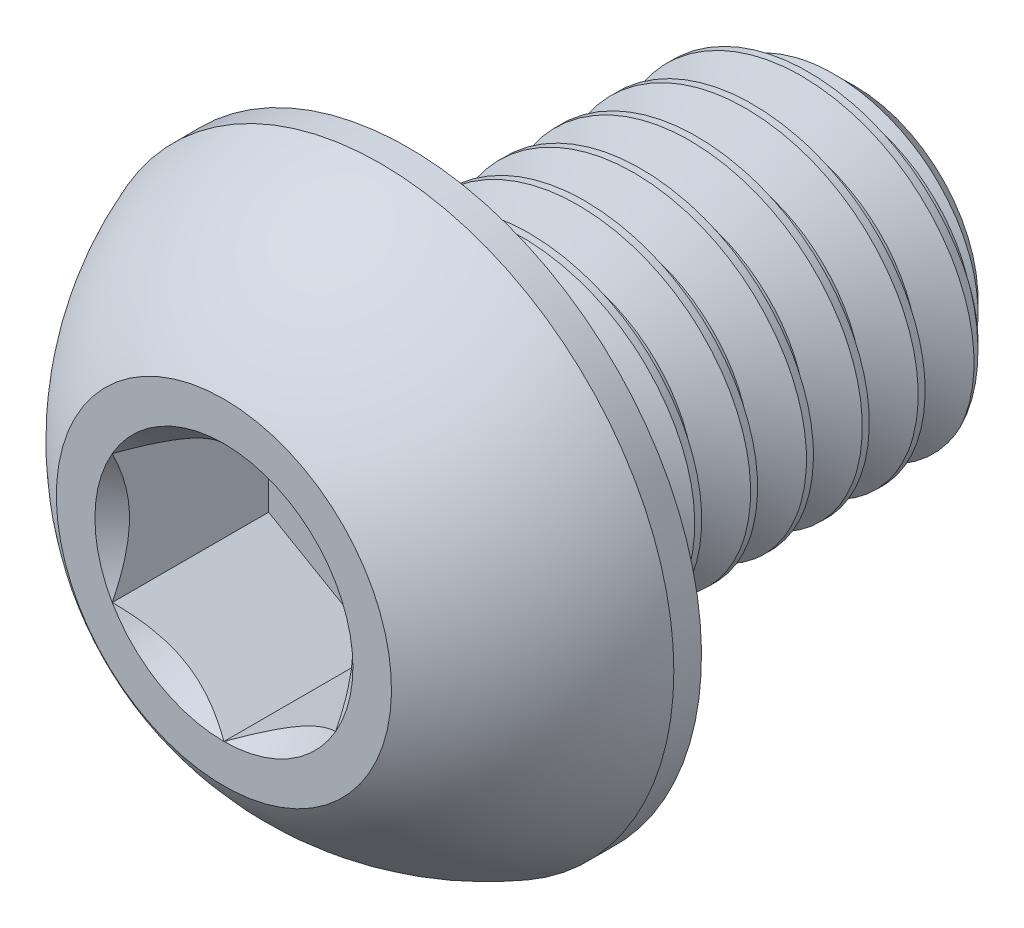
from build123d import *

# Parameters (mm, degrees)
CUT_EXTRUDE1_DEPTH = 2.8
CUT_SWEEP1_PITCH   = 1


# Read off the part's stored shape, not the designer's step: Split1
with BuildPart() as part:
    # Sketch2 → Revolve1 (revolve)
    with BuildSketch(Plane(origin=(0, 0, 0), x_dir=(0, 0, -1), z_dir=(1, 0, 0)), mode=Mode.PRIVATE) as revolve1_sk:
        with BuildLine():
            Line((-5.65, 0), (5.65, 0))
            Line((5.65, 0), (5.65, 2.2))
            Line((5.65, 2.2), (4.85, 3))
            Line((4.85, 3), (-2.35, 3))
            Line((-2.35, 3), (-2.35, 5.25))
            Line((-2.35, 5.25), (-2.845, 5.25))
            ThreePointArc((-2.845, 5.25), (-4.433520981, 4.356906156), (-5.65, 3))
            Line((-5.65, 3), (-5.65, 0))
        make_face()
    revolve(revolve1_sk.sketch.rotate(Axis((0, 0, 5.65), (0, 0, -1)), 180), axis=Axis((0, 0, 5.65), (0, 0, -1)))

    # Sketch3 → Cut-Extrude1 (cut)
    with BuildSketch(Plane.XY.offset(5.65)):
        Polygon((0, 2.309401077), (-2, 1.154700538), (-2, -1.154700538), (0, -2.309401077), (2, -1.154700538), (2, 1.154700538), align=None)
    extrude(amount=-CUT_EXTRUDE1_DEPTH, mode=Mode.SUBTRACT)

    # Cut-Extrude2 cone 1 section (through the dimple's axis) → Cut-Extrude2 (revolve, cut)
    with BuildSketch(Plane(origin=(0, 0, 5.65), x_dir=(0, -1, 0), z_dir=(1, 0, 0))):
        Polygon((0, 0), (2.309401077, 0), (0, 2.309401077), align=None)
    revolve(axis=Axis((0, 0, 5.65), (0, 0, -1)), mode=Mode.SUBTRACT)


with BuildPart() as body_2:
    # Split1: the piece on the far side of the plane
    add(part.part)
    split(bisect_by=Plane.XY.offset(2.35), keep=Keep.BOTTOM)

    # Cut-Sweep1: the profile of Sketch6 screwed along a right-hand helix of 9 turns, 8 arcs to a turn; built about Z, then put on its axis
    cut_sweep1_z = Axis((0, 0, 0), (0, 0, 1))
    cut_sweep1_corners = [(2.350480947, 0, -0.375), (2.350480947, 0, -0.5), (3.054126588, 0, -0.90625), (3.054126588, 0, 0.03125)]
    with BuildLine(mode=Mode.PRIVATE) as cut_sweep1_profile:
        Line(cut_sweep1_corners[0], cut_sweep1_corners[1])
        Line(cut_sweep1_corners[1], cut_sweep1_corners[2])
        Line(cut_sweep1_corners[2], cut_sweep1_corners[3])
        Line(cut_sweep1_corners[3], cut_sweep1_corners[0])
    cut_sweep1_cap = Face(cut_sweep1_profile.wire())
    cut_sweep1_turn_angles = [0, 22.5, 45, 67.5, 90, 112.5, 135, 157.5, 180, 202.5, 225, 247.5, 270, 292.5, 315, 337.5, 360]
    cut_sweep1_turn_weights = [1, 0.9238795325112867, 1, 0.9238795325112867, 1, 0.9238795325112867, 1, 0.9238795325112867, 1, 0.9238795325112867, 1, 0.9238795325112867, 1, 0.9238795325112867, 1, 0.9238795325112867, 1]
    cut_sweep1_turn_rails = [Edge.make_bspline([Vector(p[0], p[1], 0).rotate(cut_sweep1_z, cut_sweep1_turn_angles[k]) / cut_sweep1_turn_weights[k] + Vector(0, 0, p[2] + CUT_SWEEP1_PITCH * cut_sweep1_turn_angles[k] / 360) for k in range(17)], [0, 0, 0, 1, 1, 2, 2, 3, 3, 4, 4, 5, 5, 6, 6, 7, 7, 8, 8, 8], 2, cut_sweep1_turn_weights) for p in cut_sweep1_corners]
    cut_sweep1_turn_sides = [Face.make_surface_from_curves(cut_sweep1_turn_rails[p[0]], cut_sweep1_turn_rails[p[1]]) for p in [(0, 1), (1, 2), (2, 3), (3, 0)]]
    cut_sweep1_turn = Solid(Shell([*cut_sweep1_turn_sides, cut_sweep1_cap, cut_sweep1_cap.rotate(cut_sweep1_z, 360).moved(Location((0, 0, CUT_SWEEP1_PITCH * 360 / 360)))]))
    cut_sweep1_each = [*[cut_sweep1_turn.moved(Location((0, 0, CUT_SWEEP1_PITCH * i))) for i in range(9)]]
    add(Plane(origin=(0, 0, -5.65), x_dir=(0, 1, 0), z_dir=(0, 0, 1)) * Compound([cut_sweep1_each[i] for i in range(0, 9, 2)]), mode=Mode.SUBTRACT)
    add(Plane(origin=(0, 0, -5.65), x_dir=(0, 1, 0), z_dir=(0, 0, 1)) * Compound([cut_sweep1_each[i] for i in range(1, 9, 2)]), mode=Mode.SUBTRACT)


with BuildPart() as part_1:
    add(part.part)

    # Split1
    split(bisect_by=Plane.XY.offset(2.35), keep=Keep.TOP)

    add(body_2.part)  # Boss-Extrude1 merges body 2
    # Boss-Extrude1 cone 1 section (through the dimple's axis) → Boss-Extrude1 (revolve)
    with BuildSketch(Plane(origin=(0, 0, 2.35), x_dir=(0, -1, 0), z_dir=(1, 0, 0))):
        Polygon((0, 0), (3, 0), (0, 5.196152423), align=None)
    revolve(axis=Axis((0, 0, 2.35), (0, 0, -1)))


solid = part_1.part
